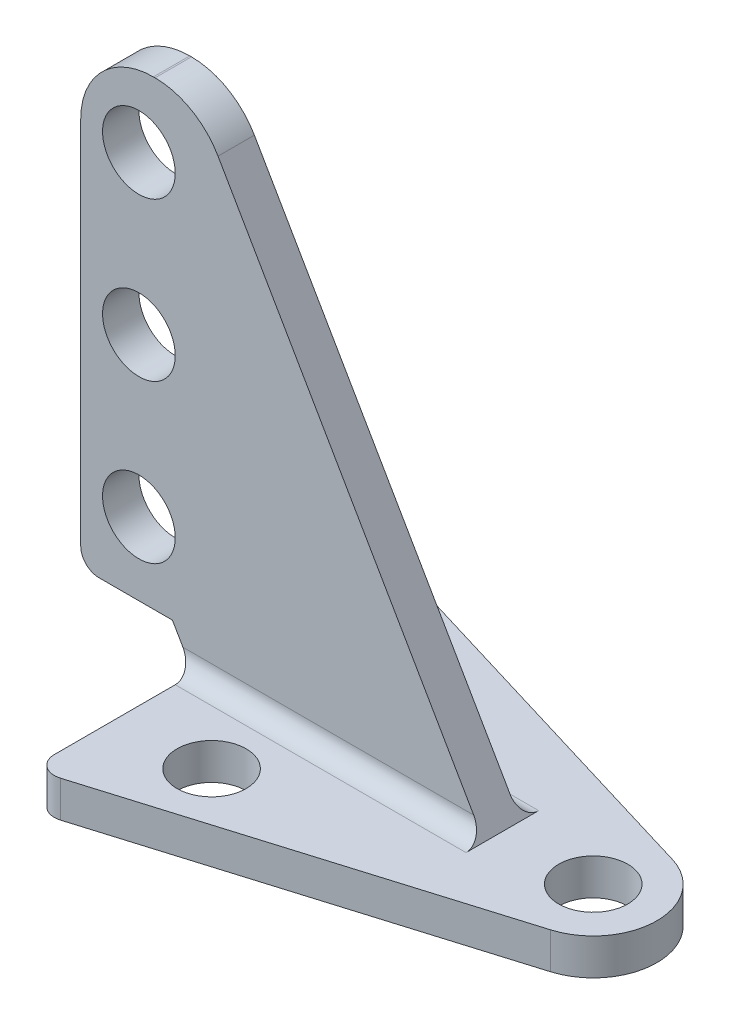
from build123d import *

# Parameters (mm, degrees)
IZIM1_R                     = 0.95
Y_KSEKLIK_EKSTR_ZYON1_DEPTH = 1
RADYUS1_R                   = 0.5
IZIM2_R                     = 1
Y_KSEKLIK_EKSTR_ZYON2_DEPTH = 0.5
RADYUS2_R                   = 0.5
RADYUS3_R                   = 2


with BuildPart() as part:
    # Çizim1 → Yükseklik-Ekstrüzyon1 (new body)
    with BuildSketch(Plane(origin=(0, 0, 0), x_dir=(1, 0, 0), z_dir=(0, 1, 0))):
        with BuildLine():
            Line((-2.5, 5), (-2.5, -5))
            Line((-2.5, -5), (8.506062625, -1.675231512))
            ThreePointArc((8.506062625, -1.675231512), (9.75, 0), (8.506062625, 1.675231512))
            Line((8.506062625, 1.675231512), (-2.5, 5))
        make_face()
        with Locations(Location((0, 2.5, 0), (0, 0, 270))):
            Circle(IZIM1_R, mode=Mode.SUBTRACT)
        with Locations(Location((0, -2.5, 0), (0, 0, 270))):
            Circle(IZIM1_R, mode=Mode.SUBTRACT)
        with Locations(Location((8, 0, 0), (0, 0, 270))):
            Circle(IZIM1_R, mode=Mode.SUBTRACT)
    extrude(amount=Y_KSEKLIK_EKSTR_ZYON1_DEPTH)

    # Radyus1
    radyus1_edges = [part.edges().sort_by_distance(p)[0] for p in [
        (-2.5, 0.5, 5),
        (-2.5, 0.5, -5),
    ]]
    fillet(radyus1_edges, radius=RADYUS1_R)

    # Çizim2 → Yükseklik-Ekstrüzyon2 (add, symmetric)
    with BuildSketch(Plane.XY):
        Polygon((-2.5, 1), (-3.077350269, 2), (-5.6, 2), (-5.6, 14.68320138), (-2.4, 14.68320138), (5.5, 1), align=None)
        with Locations((-4, 4)):
            Circle(IZIM2_R, mode=Mode.SUBTRACT)
        with Locations((-4, 12.68320138)):
            Circle(IZIM2_R, mode=Mode.SUBTRACT)
        with Locations((-4, 8.34160069)):
            Circle(IZIM2_R, mode=Mode.SUBTRACT)
    extrude(amount=Y_KSEKLIK_EKSTR_ZYON2_DEPTH, both=True)

    # Radyus2
    # the kernel refuses this fillet: 0.5 mm, written as the material it adds along each edge
    with BuildSketch(Plane(origin=(6.75, 1, 0.5), x_dir=(0, 0, 1), z_dir=(-1, 0, 0))) as radyus2_piece_1_section:
        with BuildLine():
            CenterArc((RADYUS2_R, RADYUS2_R), RADYUS2_R, 180, 90)
            Line((0, RADYUS2_R), (0, 0))
            Line((0, 0), (RADYUS2_R, 0))
        make_face()
    radyus2_piece_1 = extrude(amount=9.25, mode=Mode.PRIVATE)
    radyus2_piece_1 = split(radyus2_piece_1, bisect_by=Plane(origin=(4.44326915, 2.830311522, 0.613693195), z_dir=(-0.8660254037844398, -0.49999999999999806, 0)), keep=Keep.TOP, mode=Mode.PRIVATE)
    radyus2_piece_1 = split(radyus2_piece_1, bisect_by=Plane(origin=(-1.55673085, -0.633790093, 0.613693195), z_dir=(0.8660254037844397, 0.4999999999999983, 0)), keep=Keep.TOP, mode=Mode.PRIVATE)
    add(radyus2_piece_1)
    with BuildSketch(Plane(origin=(6.75, 1, 0.5), x_dir=(0, 0, 1), z_dir=(-1, 0, 0))) as radyus2_piece_2_section:
        with BuildLine():
            CenterArc((RADYUS2_R, RADYUS2_R), RADYUS2_R, 180, 90)
            Line((0, RADYUS2_R), (0, 0))
            Line((0, 0), (RADYUS2_R, 0))
        make_face()
    radyus2_piece_2 = extrude(amount=10.5, mode=Mode.PRIVATE)
    radyus2_piece_2 = split(radyus2_piece_2, bisect_by=Plane(origin=(-2.5, 1.215059026, 0.553236256), z_dir=(-1, 0, 0)), keep=Keep.TOP, mode=Mode.PRIVATE)
    radyus2_piece_2 = split(radyus2_piece_2, bisect_by=Plane(origin=(-2.608643838, 1.188176648, 0.553236256), z_dir=(0.8660254037844397, 0.4999999999999983, 0)), keep=Keep.TOP, mode=Mode.PRIVATE)
    add(radyus2_piece_2)
    with BuildSketch(Plane(origin=(6.75, 1, -0.5), x_dir=(0, 0, -1), z_dir=(-1, 0, 0))) as radyus2_piece_3_section:
        with BuildLine():
            CenterArc((RADYUS2_R, -RADYUS2_R), RADYUS2_R, 90, 90)
            Line((0, -RADYUS2_R), (0, 0))
            Line((0, 0), (RADYUS2_R, 0))
        make_face()
    radyus2_piece_3 = extrude(amount=9.25, mode=Mode.PRIVATE)
    radyus2_piece_3 = split(radyus2_piece_3, bisect_by=Plane(origin=(4.44326915, 2.830311522, -0.613693195), z_dir=(-0.8660254037844398, -0.49999999999999806, 0)), keep=Keep.TOP, mode=Mode.PRIVATE)
    radyus2_piece_3 = split(radyus2_piece_3, bisect_by=Plane(origin=(-1.55673085, -0.633790093, -0.613693195), z_dir=(0.8660254037844397, 0.4999999999999983, 0)), keep=Keep.TOP, mode=Mode.PRIVATE)
    add(radyus2_piece_3)
    with BuildSketch(Plane(origin=(6.75, 1, -0.5), x_dir=(0, 0, -1), z_dir=(-1, 0, 0))) as radyus2_piece_4_section:
        with BuildLine():
            CenterArc((RADYUS2_R, -RADYUS2_R), RADYUS2_R, 90, 90)
            Line((0, -RADYUS2_R), (0, 0))
            Line((0, 0), (RADYUS2_R, 0))
        make_face()
    radyus2_piece_4 = extrude(amount=10.5, mode=Mode.PRIVATE)
    radyus2_piece_4 = split(radyus2_piece_4, bisect_by=Plane(origin=(-2.5, 1.215059026, -0.553236256), z_dir=(-1, 0, 0)), keep=Keep.TOP, mode=Mode.PRIVATE)
    radyus2_piece_4 = split(radyus2_piece_4, bisect_by=Plane(origin=(-2.608643838, 1.188176648, -0.553236256), z_dir=(0.8660254037844397, 0.4999999999999983, 0)), keep=Keep.TOP, mode=Mode.PRIVATE)
    add(radyus2_piece_4)
    # the kernel refuses this fillet: 0.5 mm, written as the material it takes off along each edge
    with BuildSketch(Plane(origin=(-5.6, 2, 1.75), x_dir=(0, 1, 0), z_dir=(0, 0, -1))) as radyus2_2_piece_1:
        with BuildLine():
            CenterArc((RADYUS2_R, RADYUS2_R), RADYUS2_R, 180, 90)
            Line((0, RADYUS2_R), (0, 0))
            Line((0, 0), (RADYUS2_R, 0))
        make_face()
    extrude(amount=3.5, mode=Mode.SUBTRACT)

    # Radyus3
    radyus3_edges = [part.edges().sort_by_distance(p)[0] for p in [
        (-5.6, 14.68320138, 0),
        (-2.4, 14.68320138, 0),
    ]]
    fillet(radyus3_edges, radius=RADYUS3_R)


solid = part.part
